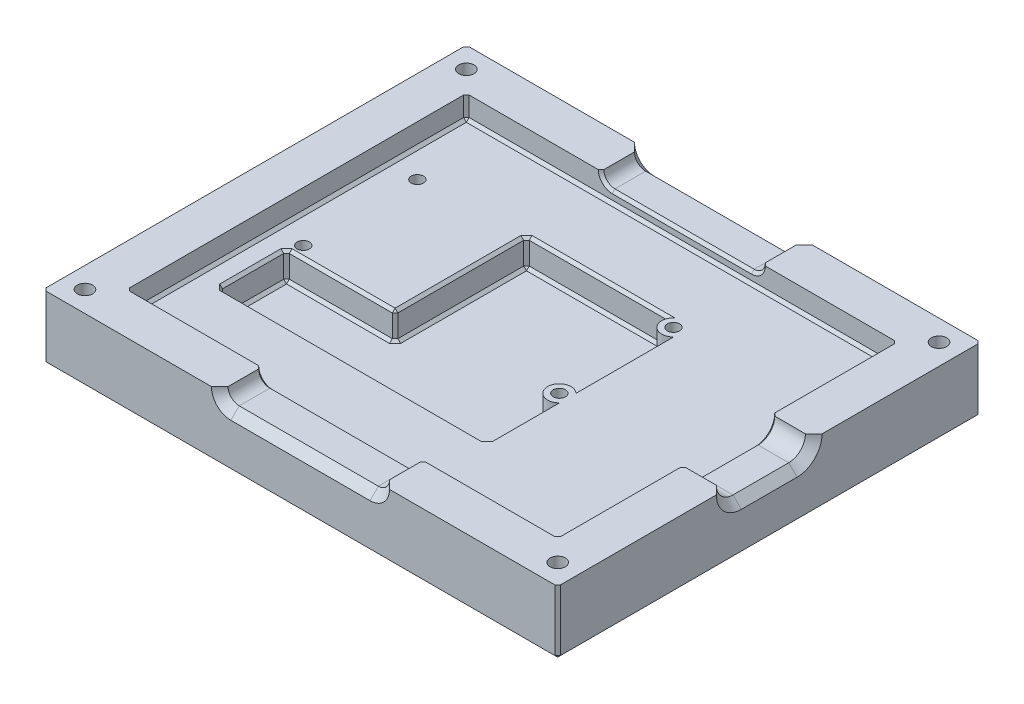
from build123d import *

# Parameters (mm, degrees)
SKETCH1_W                = 154.8
SKETCH1_H                = 121.9997
SKETCH1_R                = 2.2
BOSS_EXTRUDE1_DEPTH      = 10
SKETCH2_W                = 184.8
SKETCH2_H                = 151.9997
SKETCH2_W_2              = 154.8
SKETCH2_H_2              = 121.9997
BOSS_EXTRUDE2_DEPTH      = 18
SKETCH2_2_W              = 184.8
SKETCH2_2_H              = 151.9997
SKETCH2_2_W_2            = 154.8
SKETCH2_2_H_2            = 121.9997
BOSS_EXTRUDE3_DEPTH      = 5
CUT_EXTRUDE1_DEPTH       = 229.604349915
CUT_EXTRUDE2_REACH       = 232.747
M5_CLEARANCE_HOLE1_D     = 5.5
M5_CLEARANCE_HOLE1_DEPTH = 23
M5_CLEARANCE_HOLE1_TIP   = 1.652366702
CUT_EXTRUDE3_DEPTH       = 6
CHAMFER1_SIZE            = 1
CHAMFER2_SIZE            = 3


with BuildPart() as part:
    # Sketch1 → Boss-Extrude1 (new body)
    with BuildSketch(Plane(origin=(0, 0, 0), x_dir=(1, 0, 0), z_dir=(0, 1, 0))):
        with Locations((77.4, 60.99985)):
            Rectangle(SKETCH1_W, SKETCH1_H)
        with Locations(Location((10, 53.3997, 0), (0, 0, 270))):
            Circle(SKETCH1_R, mode=Mode.SUBTRACT)
        with Locations(Location((10, 94.3997, 0), (0, 0, 270))):
            Circle(SKETCH1_R, mode=Mode.SUBTRACT)
        with Locations(Location((102, 94.3997, 0), (0, 0, 270))):
            Circle(SKETCH1_R, mode=Mode.SUBTRACT)
        with Locations(Location((102, 53.3997, 0), (0, 0, 270))):
            Circle(SKETCH1_R, mode=Mode.SUBTRACT)
        with BuildLine():
            Line((8, 49.3997), (8, 25.4))
            Line((8, 25.4), (104, 25.4))
            Line((104, 25.4), (104, 49.706462937))
            ThreePointArc((104, 49.706462937), (97.8, 53.3997), (104, 57.092937063))
            Line((104, 57.092937063), (104, 90.706462937))
            ThreePointArc((104, 90.706462937), (98.94961445, 91.512634363), (98.422291236, 96.5997))
            Line((98.422291236, 96.5997), (47, 96.5997))
            Line((47, 96.5997), (47, 49.3997))
            Line((47, 49.3997), (8, 49.3997))
        make_face(mode=Mode.SUBTRACT)
    extrude(amount=BOSS_EXTRUDE1_DEPTH)

    # Sketch2 → Boss-Extrude2 (add)
    with BuildSketch(Plane.XZ):
        with Locations((77.4, -60.99985)):
            Rectangle(SKETCH2_W, SKETCH2_H)
        with Locations((77.4, -60.99985)):
            Rectangle(SKETCH2_W_2, SKETCH2_H_2, mode=Mode.SUBTRACT)
    extrude(amount=-BOSS_EXTRUDE2_DEPTH)

    # Sketch2<2> → Boss-Extrude3 (add)
    # profile 1 of 2: a face of its own
    with BuildSketch(Plane.XZ):
        with Locations((77.4, -60.99985)):
            Rectangle(SKETCH2_2_W, SKETCH2_2_H)
        with Locations((77.4, -60.99985)):
            Rectangle(SKETCH2_2_W_2, SKETCH2_2_H_2, mode=Mode.SUBTRACT)
    # profile 2 of 2: a face of its own
    with BuildSketch(Plane.XZ):
        with Locations((77.4, -60.99985)):
            Rectangle(SKETCH2_2_W_2, SKETCH2_2_H_2)
    extrude(amount=BOSS_EXTRUDE3_DEPTH)

    # Sketch3 → Cut-Extrude1 (cut, through all)
    with BuildSketch(Plane.XY.offset(15)):
        with BuildLine():
            Line((52.4, 22), (102.4, 22))
            ThreePointArc((102.4, 22), (106.4, 18), (102.4, 14))
            Line((102.4, 14), (52.4, 14))
            ThreePointArc((52.4, 14), (48.4, 18), (52.4, 22))
        make_face()
    extrude(amount=-CUT_EXTRUDE1_DEPTH, mode=Mode.SUBTRACT)

    # Sketch4 → Cut-Extrude2 (cut, up to next)
    with BuildSketch(Plane(origin=(169.8, 0, 0), x_dir=(0, 0, -1), z_dir=(1, 0, 0)), mode=Mode.PRIVATE) as cut_extrude2_sk1:
        with BuildLine():
            Line((50.99985, 24), (70.99985, 24))
            ThreePointArc((70.99985, 24), (76.99985, 18), (70.99985, 12))
            Line((70.99985, 12), (50.99985, 12))
            ThreePointArc((50.99985, 12), (44.99985, 18), (50.99985, 24))
        make_face()
    cut_extrude2_tool1 = extrude(cut_extrude2_sk1.sketch, amount=-CUT_EXTRUDE2_REACH, mode=Mode.PRIVATE) & part.part
    add(cut_extrude2_tool1.solids().sort_by_distance((169.8, 18, -60.99985))[0], mode=Mode.SUBTRACT)

    # M5 Clearance Hole1
    with Locations(Plane(origin=(0, 18, 0), x_dir=(1, 0, 0), z_dir=(0, 1, 0))):
        with Locations((162.3, 129.4997), (162.3, -7.5), (-7.5, 129.4997), (-7.5, -7.5)):
            Hole(M5_CLEARANCE_HOLE1_D / 2, depth=M5_CLEARANCE_HOLE1_DEPTH)
            with Locations((0, 0, -(M5_CLEARANCE_HOLE1_DEPTH + M5_CLEARANCE_HOLE1_TIP / 2))):  # 118° drill point
                Cone(0, M5_CLEARANCE_HOLE1_D / 2, M5_CLEARANCE_HOLE1_TIP, mode=Mode.SUBTRACT)

    # Sketch7 → Cut-Extrude3 (cut)
    with BuildSketch(Plane.XZ.offset(5)):
        Polygon((-3.4, 9.867136104), (-7.5, 12.234272207), (-11.6, 9.867136104), (-11.6, 5.132863896), (-7.5, 2.765727793), (-3.4, 5.132863896), align=None)
        Polygon((158.2, 9.867136104), (158.2, 5.132863896), (162.3, 2.765727793), (166.4, 5.132863896), (166.4, 9.867136104), (162.3, 12.234272207), align=None)
        Polygon((158.2, -127.132563896), (158.2, -131.866836104), (162.3, -134.233972207), (166.4, -131.866836104), (166.4, -127.132563896), (162.3, -124.765427793), align=None)
        Polygon((-3.4, -127.132563896), (-7.5, -124.765427793), (-11.6, -127.132563896), (-11.6, -131.866836104), (-7.5, -134.233972207), (-3.4, -131.866836104), align=None)
    extrude(amount=-CUT_EXTRUDE3_DEPTH, mode=Mode.SUBTRACT)

    # Chamfer1
    chamfer1_edges = [part.edges().sort_by_distance(p)[0] for p in [
        (77.4, 14, 0),
        (77.4, 14, -121.9997),
        (49.571572875, 15.171572875, -121.9997),
        (49.571572875, 15.171572875, 0),
        (105.228427125, 15.171572875, 0),
        (105.228427125, 15.171572875, -121.9997),
        (154.8, 10, -60.99985),
        (154.8, 12, -60.99985),
        (154.8, 13.757359313, -46.757209313),
        (154.8, 13.757359313, -75.242490687),
        (77.4, 10, -121.9997),
        (27.5, 0, -49.3997),
        (47, 5, -49.3997),
        (8, 0, -37.39985),
        (8, 5, -49.3997),
        (56, 0, -25.4),
        (8, 5, -25.4),
        (104, 0, -37.553231469),
        (104, 5, -25.4),
        (97.8, 0, -53.3997),
        (104, 0, -73.8997),
        (98.94961445, 0, -91.512634363),
        (72.711145618, 0, -96.5997),
        (47, 0, -72.9997),
        (47, 5, -96.5997),
        (27.5, 10, -49.3997),
        (8, 10, -37.39985),
        (56, 10, -25.4),
        (104, 10, -37.553231469),
        (104, 10, -73.8997),
        (72.711145618, 10, -96.5997),
        (47, 10, -72.9997),
        (0, 10, -60.99985),
        (154.8, 14, 0),
        (0, 14, -121.9997),
        (0, 14, 0),
        (154.8, 14, -121.9997),
        (-15, 6.5, 15),
        (169.8, 6.5, 15),
        (169.8, 6.5, -136.9997),
        (-15, 6.5, -136.9997),
        (169.8, -5, -60.99985),
        (77.4, -5, 15),
        (77.4, 10, 0),
        (-15, -5, -60.99985),
        (77.4, -5, -136.9997),
    ]]
    chamfer(chamfer1_edges, length=CHAMFER1_SIZE - 0.0001)  # a hair under: the kernel refuses the full size

    # Chamfer2
    chamfer2_edges = [part.edges().sort_by_distance(p)[0] for p in [
        (77.4, 14, -136.9997),
        (49.571572875, 15.171572875, -136.9997),
        (105.228427125, 15.171572875, -136.9997),
        (49.571572875, 15.171572875, 15),
        (77.4, 14, 15),
        (105.228427125, 15.171572875, 15),
        (169.8, 13.757359313, -75.242490687),
        (169.8, 13.757359313, -46.757209313),
        (169.8, 12, -60.99985),
    ]]
    chamfer(chamfer2_edges, length=CHAMFER2_SIZE)


solid = part.part
